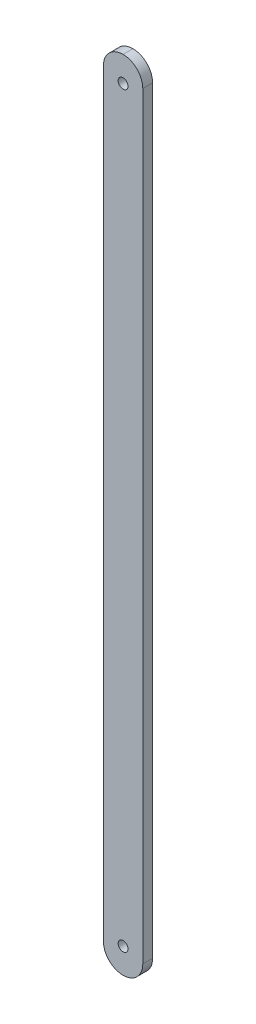
from build123d import *

# Parameters (mm, degrees)
SKETCH1_W           = 25.4
SKETCH1_H           = 514.35
BOSS_EXTRUDE1_DEPTH = 6.35
FILLET1_R           = 12.7
FILLET2_R           = 12.7
SKETCH2_R           = 3.175
CUT_EXTRUDE1_DEPTH  = 259.504280671


with BuildPart() as part:
    # Sketch1 → Boss-Extrude1 (new body)
    with BuildSketch(Plane.XY):
        with Locations((-12.7, 0)):
            Rectangle(SKETCH1_W, SKETCH1_H)
    extrude(amount=BOSS_EXTRUDE1_DEPTH)

    # Fillet1
    fillet1_edges = [part.edges().sort_by_distance(p)[0] for p in [
        (-25.4, 257.175, 3.175),
        (0, 257.175, 3.175),
    ]]
    fillet(fillet1_edges, radius=FILLET1_R - 0.0001)  # a hair under: the kernel refuses the full size

    # Fillet2
    fillet2_edges = [part.edges().sort_by_distance(p)[0] for p in [
        (-25.4, -257.175, 3.175),
        (0, -257.175, 3.175),
    ]]
    fillet(fillet2_edges, radius=FILLET2_R - 0.0001)  # a hair under: the kernel refuses the full size

    # Sketch2 → Cut-Extrude1 (cut, through all)
    with BuildSketch(Plane.XY.offset(6.35)):
        with Locations((-12.7, 240.919)):
            Circle(SKETCH2_R)
        with Locations((-12.7, -240.919)):
            Circle(SKETCH2_R)
    extrude(amount=-CUT_EXTRUDE1_DEPTH, mode=Mode.SUBTRACT)


solid = part.part
